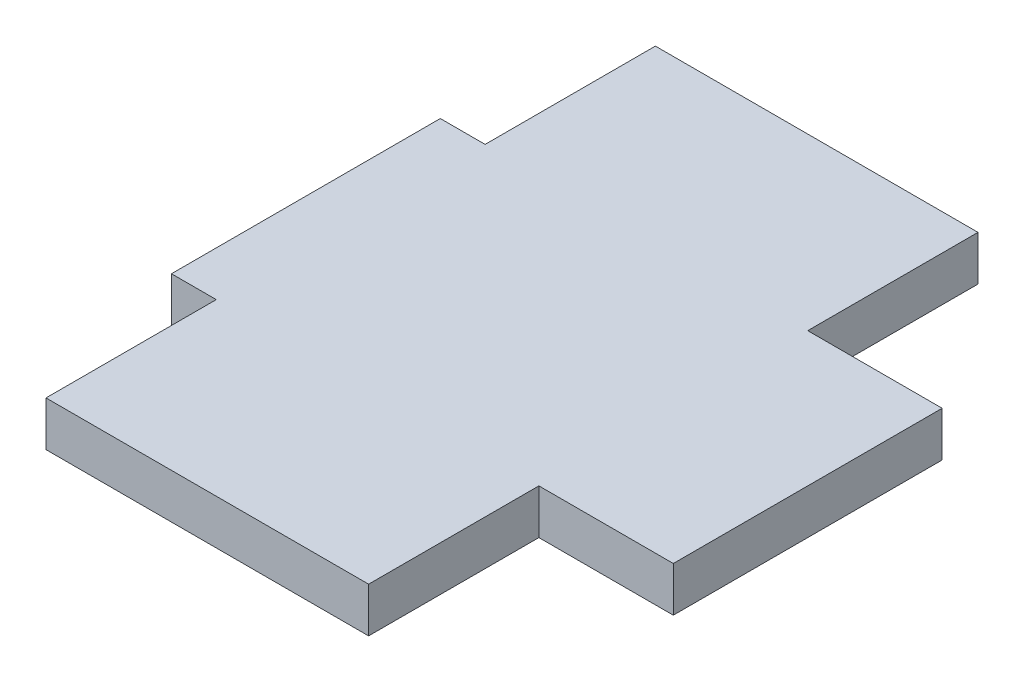
from build123d import *

# Parameters (mm, degrees)
BOSS_EXTRUDE1_DEPTH = 3.175


with BuildPart() as part:
    # Sketch1 → Boss-Extrude1 (new body)
    with BuildSketch(Plane(origin=(0, 0, 0), x_dir=(1, 0, 0), z_dir=(0, 1, 0))):
        Polygon((0, 0), (22.86, 0), (22.86, 12.065), (32.385, 12.065), (32.385, 31.115), (22.86, 31.115), (22.86, 43.18), (0, 43.18), (0, 31.115), (-3.175, 31.115), (-3.175, 12.065), (0, 12.065), align=None)
    extrude(amount=BOSS_EXTRUDE1_DEPTH)


solid = part.part
